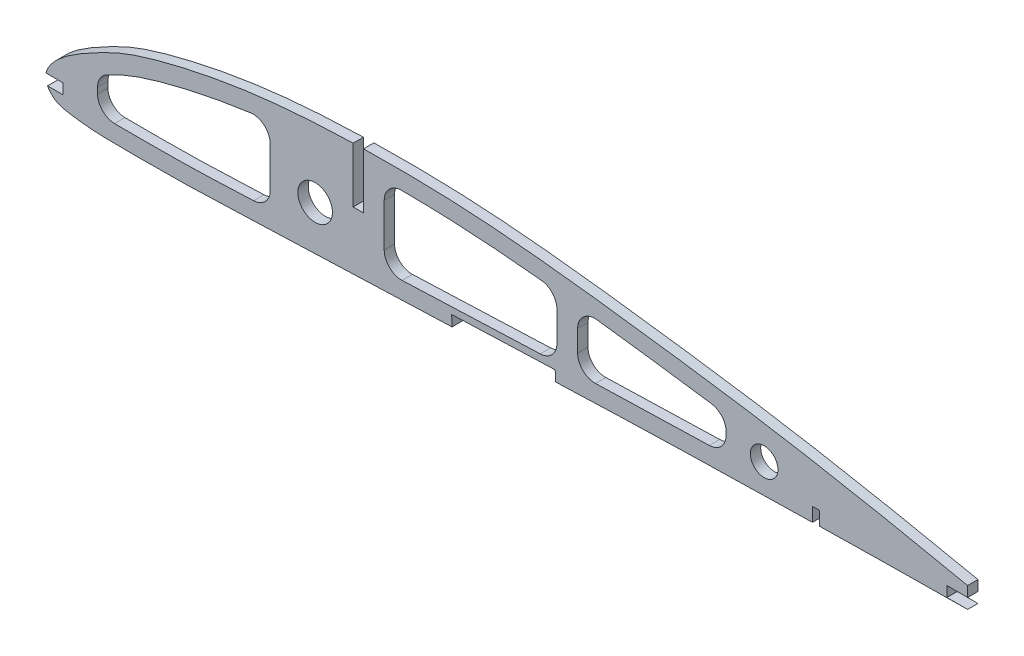
from build123d import *

# Parameters (mm, degrees)
SKETCH_1_R          = 5
SKETCH_1_R_2        = 4
EXTRUDE_1_DEPTH     = 3
CUT_EXTRUDE_2_DEPTH = 3


# Read off the part's stored shape, not the designer's step: 切除-拉伸2
with BuildPart() as part:
    # 草图1 → 凸台-拉伸1 (new body)
    with BuildSketch(Plane.XY):
        with BuildLine():
            Line((90, 12.3715), (90, 28.372426217))
            add(Edge.make_bspline(
                [(90, 28.372426217), (89.259446982, 28.350928743), (82.363996343, 28.13322439), (72.403347361, 27.586524792), (60.185862052, 26.226268085), (51.080991088, 24.79810862), (42.033943524, 23.000087944), (34.581994337, 21.174922903), (28.697351661, 19.44563851), (24.361981086, 17.983441115), (20.174828998, 16.207949367), (16.078941989, 14.139912989), (12.040296713, 11.946766626), (8.14011433, 9.56039573), (5.153679337, 7.316395724), (3.100060439, 5.200618052), (1.813825976, 3.470730924), (1.237398467, 2.180506339), (1.085380705, 1.529058937), (1.078882286, 1.5)],
                knots=[0.345773533, 0.345773533, 0.345773533, 0.345773533, 0.349398211, 0.379527288, 0.394591827, 0.409656366, 0.424720905, 0.439785444, 0.447317713, 0.454849983, 0.462382252, 0.469914522, 0.477446791, 0.484979061, 0.49251133, 0.496277465, 0.5000436, 0.503809734, 0.503985678, 0.503985678, 0.503985678, 0.503985678], degree=3))
            Line((1.078882286, 1.5), (6, 1.5))
            Line((6, 1.5), (6, -1.5))
            Line((6, -1.5), (1.522379628, -1.5))
            add(Edge.make_bspline(
                [(1.522379628, -1.5), (1.617903461, -1.678770523), (2.068186491, -2.42442122), (3.143139608, -3.601090845), (4.854253, -4.619355756), (6.927567017, -5.105597911), (9.209034621, -5.454839075), (12.219971865, -5.84289763), (16.020132359, -6.14266222), (20.609524976, -6.2611368), (25.231457517, -6.286948592), (31.397380169, -6.280305851), (39.107274969, -6.240736398), (48.336813051, -6.022096429), (57.579935967, -5.612990736), (66.840654471, -5.242934226), (76.096556555, -4.921715721), (88.435998513, -4.515955408), (103.853120896, -3.973102953), (122.354625015, -3.248110744), (140.857835973, -2.495489966), (159.368527813, -1.804089638), (177.884173919, -1.222493213), (196.4033921, -0.774877257), (211.439290174, -0.454334834), (220.305576898, -0.265987383), (223, -0.210849605)],
                knots=[0.510182255, 0.510182255, 0.510182255, 0.510182255, 0.511342004, 0.515108139, 0.518874273, 0.522640408, 0.526406543, 0.530172677, 0.537704947, 0.545237216, 0.552769486, 0.560301755, 0.575366294, 0.590430833, 0.605495372, 0.620559911, 0.63562445, 0.650688989, 0.680818067, 0.710947144, 0.741076222, 0.7712053, 0.801334378, 0.831463456, 0.861592533, 0.874744372, 0.874744372, 0.874744372, 0.874744372], degree=3))
            Line((223, -0.210849605), (223, 3.788737263))
            Line((223, 3.788737263), (225, 3.788737263))
            Line((225, 3.788737263), (225, -0.170338801))
            add(Edge.make_bspline(
                [(225, -0.170338801), (227.811595191, -0.114017747), (236.796798206, 0.056910764), (251.961175933, 0.256656825), (270.471854229, 0.429163033), (282.824771355, 0.587434741), (289, 0.610062865)],
                knots=[0.877998396, 0.877998396, 0.877998396, 0.877998396, 0.891721611, 0.921850689, 0.951979767, 0.982108845, 0.982108845, 0.982108845, 0.982108845], degree=3))
            Line((289, 0.610062865), (289, 1.816246039))
            add(Edge.make_bspline(
                [(289, 1.816246039), (276.957314444, 4.502285023), (258.861554155, 8.397620333), (234.648247971, 13.152786595), (216.448478593, 16.478914183), (198.182873559, 19.371550405), (179.850571346, 21.924148488), (161.503162682, 24.358614825), (143.127892269, 26.473190985), (124.712239059, 28.043780086), (107.994173705, 28.616385423), (97.416270032, 28.546670082), (93, 28.44913561)],
                knots=[0.017978355, 0.017978355, 0.017978355, 0.017978355, 0.07823651, 0.108365588, 0.138494666, 0.168623744, 0.198752821, 0.228881899, 0.259010977, 0.289140055, 0.319269133, 0.340879606, 0.340879606, 0.340879606, 0.340879606], degree=3))
            Line((93, 28.44913561), (93, 12.3715))
            Line((93, 12.3715), (90, 12.3715))
        make_face()
        with Locations((79, 8)):
            Circle(SKETCH_1_R, mode=Mode.SUBTRACT)
        with Locations((209, 8)):
            Circle(SKETCH_1_R_2, mode=Mode.SUBTRACT)
    extrude(amount=EXTRUDE_1_DEPTH)

    # 切除-拉伸2 outline → 切除-拉伸2 (cut)
    with BuildSketch(Plane.XY):
        with BuildLine():
            ThreePointArc((99, 6.051698891), (100.530987404, 2.450872374), (104.186380643, 1.055173873))
            add(Edge.make_bspline(
                [(104.186380643, 1.055173873), (106.39458867, 1.137544567), (108.602901821, 1.221357381), (120.131865001, 1.665786726), (129.456324286, 2.050051394), (140.592579239, 2.48797418), (142.3918285, 2.557905459), (144.191396926, 2.626842357)],
                knots=[0.470377348, 0.470377348, 0.470377348, 0.470377348, 0.5, 0.5, 0.625, 0.625, 0.649081852, 0.649081852, 0.649081852, 0.649081852], degree=3))
            ThreePointArc((144.191396926, 2.626842357), (147.602567462, 4.155973144), (149, 7.623177736))
            Line((149, 7.623177736), (149, 16.241622969))
            ThreePointArc((149, 16.241622969), (147.712532938, 19.59081678), (144.513160327, 21.215219904))
            add(Edge.make_bspline(
                [(144.513160327, 21.215219904), (143.652145828, 21.304056714), (142.791222193, 21.391146352), (137.856440927, 21.879784463), (133.787425472, 22.240923522), (125.659256001, 22.840362063), (121.601588339, 23.075546461), (113.037568805, 23.424275072), (108.53263967, 23.523953165), (104.024339014, 23.545898944)],
                knots=[0.736793621, 0.736793621, 0.736793621, 0.736793621, 0.75, 0.75, 0.8125, 0.8125, 0.875, 0.875, 0.944193059, 0.944193059, 0.944193059, 0.944193059], degree=3))
            ThreePointArc((104.024339014, 23.545898944), (100.473081733, 22.090086783), (99, 18.545958183))
            Line((99, 18.545958183), (99, 6.051698891))
        make_face()
        with BuildLine():
            ThreePointArc((155, 8.204846233), (156.525241739, 4.609563904), (160.17042201, 3.207751443))
            add(Edge.make_bspline(
                [(160.17042201, 3.207751443), (162.389721662, 3.283438922), (164.609319497, 3.356780918), (171.504636491, 3.576232826), (176.18199895, 3.713351663), (184.945921303, 3.946800138), (189.03214497, 4.046860263), (193.116453453, 4.14201244)],
                knots=[0.720326449, 0.720326449, 0.720326449, 0.720326449, 0.75, 0.75, 0.8125, 0.8125, 0.867133534, 0.867133534, 0.867133534, 0.867133534], degree=3))
            ThreePointArc((193.116453453, 4.14201244), (196.576469437, 5.64653729), (198, 9.140656115))
            Line((198, 9.140656115), (198, 9.967295711))
            ThreePointArc((198, 9.967295711), (196.781019979, 13.238975389), (193.718444833, 14.915410202))
            add(Edge.make_bspline(
                [(193.718444833, 14.915410202), (192.779013077, 15.051811632), (191.839123333, 15.187073825), (186.824226186, 15.902901834), (182.740892869, 16.465870736), (174.565909682, 17.575800313), (170.481299177, 18.120965891), (164.469973656, 18.894543341), (162.541485429, 19.138417507), (160.613475955, 19.376775938)],
                knots=[0.485575284, 0.485575284, 0.485575284, 0.485575284, 0.5, 0.5, 0.5625, 0.5625, 0.625, 0.625, 0.654532252, 0.654532252, 0.654532252, 0.654532252], degree=3))
            ThreePointArc((160.613475955, 19.376775938), (156.688458046, 18.160710613), (155, 14.41455393))
            Line((155, 14.41455393), (155, 8.204846233))
        make_face()
        with BuildLine():
            ThreePointArc((16, 3.749585631), (17.438635496, 0.240072435), (20.926673148, -1.249876658))
            add(Edge.make_bspline(
                [(20.926673148, -1.249876658), (21.809693827, -1.262827876), (22.70041751, -1.270722289), (24.744752026, -1.282014543), (25.903390676, -1.283802206), (29.38108188, -1.283541675), (31.709604831, -1.277171959), (36.343989553, -1.248263334), (38.652190318, -1.223511787), (43.261210505, -1.138923387), (45.563329713, -1.080117385), (50.168153725, -0.92677743), (52.481550313, -0.831144642), (56.932408226, -0.642663317), (59.067384966, -0.552312083), (61.20153145, -0.466222597)],
                knots=[0.097228806, 0.097228806, 0.097228806, 0.097228806, 0.109375, 0.109375, 0.125, 0.125, 0.15625, 0.15625, 0.1875, 0.1875, 0.21875, 0.21875, 0.25, 0.25, 0.27850067, 0.27850067, 0.27850067, 0.27850067], degree=3))
            ThreePointArc((61.20153145, -0.466222597), (64.606082171, 1.066165303), (66, 4.529714259))
            Line((66, 4.529714259), (66, 16.175207171))
            ThreePointArc((66, 16.175207171), (64.287676463, 19.942325894), (60.32352661, 21.129234195))
            add(Edge.make_bspline(
                [(60.32352661, 21.129234195), (59.143282742, 20.968071656), (57.964431768, 20.796736398), (53.109249428, 20.046773379), (49.445857595, 19.384253181), (42.158673028, 17.868714577), (38.533379611, 17.019586343), (33.148990447, 15.546220745), (31.362942012, 15.022439399), (27.821005995, 13.880218625), (26.067238608, 13.253271835), (22.635818059, 11.812670552), (20.957942753, 11.004847704), (19.099592195, 10.049689097), (18.896441621, 9.944700093), (18.693547477, 9.839213217)],
                knots=[0.029920383, 0.029920383, 0.029920383, 0.029920383, 0.033494004, 0.033494004, 0.044658672, 0.044658672, 0.05582334, 0.05582334, 0.061405674, 0.061405674, 0.066988008, 0.066988008, 0.072570342, 0.072570342, 0.073256353, 0.073256353, 0.073256353, 0.073256353], degree=3))
            ThreePointArc((18.693547477, 9.839213217), (16.726110517, 7.997937304), (16, 5.402967421))
            Line((16, 5.402967421), (16, 3.749585631))
        make_face()
        with BuildLine():
            add(Edge.make_bspline(
                [(289, 1.816246039), (281.978696735, 3.382299906), (274.950202385, 4.918049481), (267.913052859, 6.412186808)],
                knots=[0.017978355, 0.017978355, 0.017978355, 0.017978355, 0.053110949, 0.053110949, 0.053110949, 0.053110949], degree=3))
            Line((267.913052859, 6.412186808), (267.913052859, 3.412186808))
            Line((267.913052859, 3.412186808), (261.913052859, 3.412186808))
            Line((261.913052859, 3.412186808), (261.913052859, 0.412186808))
            Line((261.913052859, 0.412186808), (267.913052859, 0.412186808))
            add(Edge.make_bspline(
                [(267.913052859, 0.412186808), (268.766976108, 0.421284301), (275.793854693, 0.497351146), (282.824771355, 0.587434741), (289, 0.610062865)],
                knots=[0.947811677, 0.947811677, 0.947811677, 0.947811677, 0.951979767, 0.982108845, 0.982108845, 0.982108845, 0.982108845], degree=3))
            Line((289, 0.610062865), (289, 1.816246039))
        make_face()
        with BuildLine():
            Line((148.502662677, 0.788581965), (118.523611267, -0.331640805))
            Line((118.523611267, -0.331640805), (118.637941387, -3.391307734))
            add(Edge.make_bspline(
                [(118.637941387, -3.391307734), (119.876919949, -3.342267709), (127.283304342, -3.047636001), (137.274566127, -2.641239984), (146.029280896, -2.305788873), (148.614677353, -2.20911975)],
                knots=[0.704894411, 0.704894411, 0.704894411, 0.704894411, 0.710947144, 0.741076222, 0.753701211, 0.753701211, 0.753701211, 0.753701211], degree=3))
            Line((148.614677353, -2.20911975), (148.502662677, 0.788581965))
        make_face()
    extrude(amount=CUT_EXTRUDE_2_DEPTH, mode=Mode.SUBTRACT)


solid = part.part
